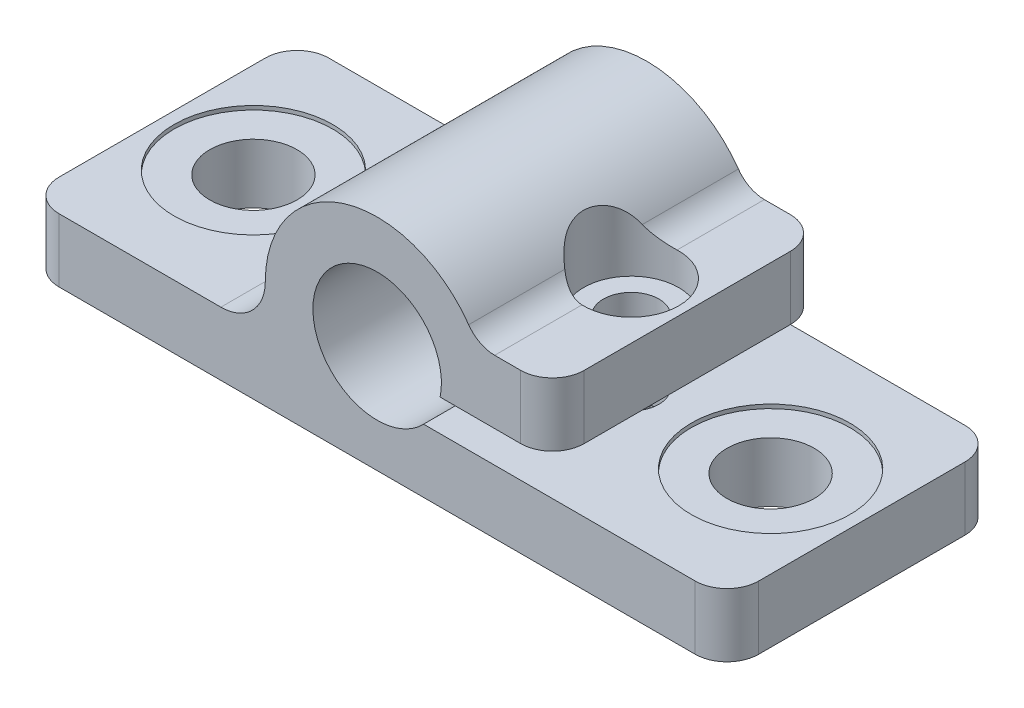
from build123d import *

# Parameters (mm, degrees)
BOSS_EXTRUDE1_DEPTH     = 8.5
CUT_EXTRUDE1_DEPTH      = 2
CUT_EXTRUDE1_DEPTH_BACK = 26.602245995
SKETCH2_R               = 2.75
CUT_EXTRUDE2_DEPTH      = 2
CUT_EXTRUDE2_DEPTH_BACK = 0.25
SKETCH2_3_R             = 5
SKETCH2_3_R_2           = 2.75
SKETCH3_R               = 1.75
CUT_EXTRUDE3_DEPTH      = 28.391148205
SKETCH3_3_R             = 3
SKETCH3_3_R_2           = 1.75
CUT_EXTRUDE4_DEPTH      = 5.85
FILLET1_R               = 2
FILLET2_R               = 2
CUT_EXTRUDE5_DEPTH      = 2


with BuildPart() as part:
    # Sketch1 → Boss-Extrude1 (new, symmetric)
    with BuildSketch(Plane.XY):
        with BuildLine():
            Line((11.05, 4), (3.970201506, 4))
            ThreePointArc((3.970201506, 4), (-3.590264914, 6.674165907), (2.926174978, 2))
            Line((2.926174978, 2), (22.05, 2))
            Line((22.05, 2), (22.05, -2))
            Line((22.05, -2), (-22.05, -2))
            Line((-22.05, -2), (-22.05, 2))
            Line((-22.05, 2), (-9.85, 2))
            ThreePointArc((-9.85, 2), (-7.870101013, 2.820101013), (-7.05, 4.8))
            ThreePointArc((-7.05, 4.8), (-1.645444408, 11.655290855), (6.281918497, 8))
            Line((6.281918497, 8), (11.05, 8))
            Line((11.05, 8), (11.05, 4))
        make_face()
    extrude(amount=BOSS_EXTRUDE1_DEPTH, both=True)

    # Sketch2 → Cut-Extrude1 (cut, two sides: drawn at the far end of the back side and taken through both)
    with BuildSketch(Plane(origin=(0, 2, 0), x_dir=(1, 0, 0), z_dir=(0, 1, 0)).offset(-CUT_EXTRUDE1_DEPTH_BACK)):
        with Locations(Location((16.3, 0, 0), (0, 0, 180))):
            Circle(SKETCH2_R)
        with Locations(Location((-16.3, 0, 0), (0, 0, 180))):
            Circle(SKETCH2_R)
    extrude(amount=CUT_EXTRUDE1_DEPTH + CUT_EXTRUDE1_DEPTH_BACK, mode=Mode.SUBTRACT)

    # Sketch2<3> → Cut-Extrude2 (cut, two sides: drawn at the far end of the back side and taken through both)
    # profile 1 of 2: a face of its own
    with BuildSketch(Plane(origin=(0, 2, 0), x_dir=(1, 0, 0), z_dir=(0, 1, 0)).offset(-CUT_EXTRUDE2_DEPTH_BACK)):
        with Locations(Location((16.3, 0, 0), (0, 0, 180))):
            Circle(SKETCH2_3_R)
        with Locations(Location((16.3, 0, 0), (0, 0, 180))):
            Circle(SKETCH2_3_R_2, mode=Mode.SUBTRACT)
    # profile 2 of 2: a face of its own
    with BuildSketch(Plane(origin=(0, 2, 0), x_dir=(1, 0, 0), z_dir=(0, 1, 0)).offset(-CUT_EXTRUDE2_DEPTH_BACK)):
        with Locations(Location((-16.3, 0, 0), (0, 0, 180))):
            Circle(SKETCH2_3_R)
        with Locations(Location((-16.3, 0, 0), (0, 0, 180))):
            Circle(SKETCH2_3_R_2, mode=Mode.SUBTRACT)
    extrude(amount=CUT_EXTRUDE2_DEPTH + CUT_EXTRUDE2_DEPTH_BACK, mode=Mode.SUBTRACT)

    # Sketch3 → Cut-Extrude3 (cut, through all)
    with BuildSketch(Plane(origin=(0, 11.85, 0), x_dir=(1, 0, 0), z_dir=(0, 1, 0))):
        with Locations(Location((7.510100753, 0, 0), (0, 0, 225.426920251))):
            Circle(SKETCH3_R)
    extrude(amount=-CUT_EXTRUDE3_DEPTH, mode=Mode.SUBTRACT)

    # Sketch3<3> → Cut-Extrude4 (cut)
    # profile 1 of 2: a face of its own
    with BuildSketch(Plane(origin=(0, 11.85, 0), x_dir=(1, 0, 0), z_dir=(0, 1, 0))):
        with Locations(Location((7.510100753, 0, 0), (0, 0, 245.83322212))):
            Circle(SKETCH3_3_R)
        with Locations(Location((7.510100753, 0, 0), (0, 0, 180))):
            Circle(SKETCH3_3_R_2, mode=Mode.SUBTRACT)
    # profile 2 of 2: a face of its own
    with BuildSketch(Plane(origin=(0, 11.85, 0), x_dir=(1, 0, 0), z_dir=(0, 1, 0))):
        with Locations(Location((7.510100753, 0, 0), (0, 0, 180))):
            Circle(SKETCH3_3_R_2)
    extrude(amount=-CUT_EXTRUDE4_DEPTH, mode=Mode.SUBTRACT)

    # Fillet1
    fillet1_edges = [part.edges().sort_by_distance(p)[0] for p in [
        (22.05, 0, 8.5),
        (22.05, 0, -8.5),
        (-22.05, 0, -8.5),
        (-22.05, 0, 8.5),
    ]]
    fillet(fillet1_edges, radius=FILLET1_R)

    # Fillet2
    # the kernel refuses this fillet: 2 mm, written as the material it adds along each edge
    with BuildSketch(Plane(origin=(6.281918497, 8, -0.075436901), x_dir=(1, 0, 0), z_dir=(0, 0, 1))) as fillet2_piece_1_section:
        with BuildLine():
            CenterArc((1.125003941, 2), FILLET2_R, 215.07061915, 54.92938085)
            ThreePointArc((-0.511884995, 0.850828729), (-0.240944724, 0.434437491), (0, 0))
            Line((0, 0), (1.125003941, 0))
        make_face()
    fillet2_piece_1 = extrude(amount=8.575436901, mode=Mode.PRIVATE)
    fillet2_piece_1 = fillet2_piece_1 - Plane(origin=(7.510100753, 8.184515376, 0), x_dir=(-0.4093940854484991, 0, 0.9123576507049125), z_dir=(0, 1, 0)) * Cylinder(3, 22, mode=Mode.PRIVATE)
    add(fillet2_piece_1)
    with BuildSketch(Plane(origin=(6.281918497, 8, -8.5), x_dir=(1, 0, 0), z_dir=(0, 0, 1))) as fillet2_piece_2_section:
        with BuildLine():
            CenterArc((1.125003941, 2), FILLET2_R, 215.07061915, 54.92938085)
            ThreePointArc((-0.511884995, 0.850828729), (-0.240944724, 0.434437491), (0, 0))
            Line((0, 0), (1.125003941, 0))
        make_face()
    fillet2_piece_2 = extrude(amount=8.575436901, mode=Mode.PRIVATE)
    fillet2_piece_2 = fillet2_piece_2 - Plane(origin=(7.510100753, 8.184515325, 0), x_dir=(-0.4093940854484991, 0, 0.9123576507049125), z_dir=(0, 1, 0)) * Cylinder(3, 22, mode=Mode.PRIVATE)
    add(fillet2_piece_2)
    # the kernel refuses this fillet: 2 mm, written as the material it takes off along each edge
    with BuildSketch(Plane(origin=(11.05, 13, -8.5), x_dir=(-1, 0, 0), z_dir=(0, -1, 0))) as fillet2_2_piece_1_section:
        with BuildLine():
            CenterArc((FILLET2_R, -FILLET2_R), FILLET2_R, 90, 90)
            Line((0, -FILLET2_R), (0, 0))
            Line((0, 0), (FILLET2_R, 0))
        make_face()
    fillet2_2_piece_1 = extrude(amount=14, mode=Mode.PRIVATE)
    fillet2_2_piece_1 = split(fillet2_2_piece_1, bisect_by=Plane(origin=(10.603264122, 2, -8.053264122), z_dir=(0, 1, 0)), keep=Keep.TOP, mode=Mode.PRIVATE)
    add(fillet2_2_piece_1, mode=Mode.SUBTRACT)
    with BuildSketch(Plane(origin=(11.05, 13, 8.5), x_dir=(-1, 0, 0), z_dir=(0, -1, 0))) as fillet2_2_piece_2_section:
        with BuildLine():
            CenterArc((FILLET2_R, FILLET2_R), FILLET2_R, 180, 90)
            Line((0, FILLET2_R), (0, 0))
            Line((0, 0), (FILLET2_R, 0))
        make_face()
    fillet2_2_piece_2 = extrude(amount=14, mode=Mode.PRIVATE)
    fillet2_2_piece_2 = split(fillet2_2_piece_2, bisect_by=Plane(origin=(10.603264122, 2, 8.053264122), z_dir=(0, 1, 0)), keep=Keep.TOP, mode=Mode.PRIVATE)
    add(fillet2_2_piece_2, mode=Mode.SUBTRACT)

    # Sketch4 → Cut-Extrude5 (cut)
    with BuildSketch(Plane.XZ.offset(2)):
        Polygon((10.772129774, 0), (9.141115264, 2.825), (5.879086243, 2.825), (4.248071732, 0), (5.879086243, -2.825), (9.141115264, -2.825), align=None)
    extrude(amount=-CUT_EXTRUDE5_DEPTH, mode=Mode.SUBTRACT)


solid = part.part
